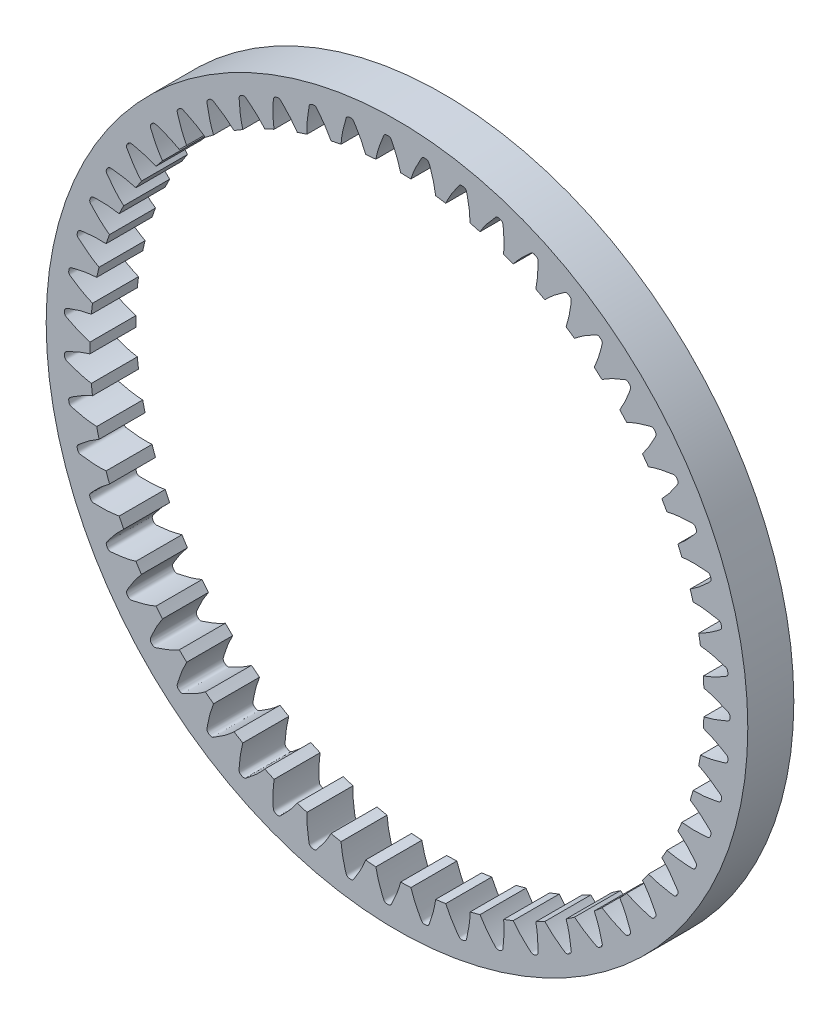
from build123d import *

# Parameters (mm, degrees)
SKETCHREVOLVESPURGEAR_W       = 4
SKETCHREVOLVESPURGEAR_H       = 4.799999985
TOOTHEXTRUDECUTSPURGEAR_DEPTH = 2
PATTERNSPURGEAR_COUNT         = 55
CUT_EXTRUDE2_DEPTH            = 45.592599845
CUT_EXTRUDE2_DEPTH_BACK       = 45.592599845
SKETCH4_R                     = 59.758715027
SKETCH4_R_2                   = 30.5


with BuildPart() as part:
    # SketchRevolveSpurGear → SpurGear (revolve)
    with BuildSketch(Plane(origin=(0, 0, 0), x_dir=(0, 0, -1), z_dir=(1, 0, 0))):
        with Locations((0, 29.099999595)):
            Rectangle(SKETCHREVOLVESPURGEAR_W, SKETCHREVOLVESPURGEAR_H)
    revolve(axis=Axis((0, 0, 0), (0, 0, -1)))

    # SketchToothSpurGear → ToothExtrudeCutSpurGear (cut, symmetric)
    with BuildSketch(Plane.XY):
        with BuildLine():
            ThreePointArc((26.661143645, -1.084352278), (26.683185723, 0), (26.661143645, 1.084352278))
            add(Edge.make_bspline(
                [(26.661143645, 1.084352278), (26.771290932, 1.060729715), (26.942432435, 1.019513731), (27.177626463, 0.954455679), (27.372992959, 0.895487945), (27.580268016, 0.827614446), (27.799153728, 0.750289731), (28.029240353, 0.662776702), (28.270468231, 0.565171604), (28.521257548, 0.454250779), (28.706807509, 0.374356526), (28.81694733, 0.315508201), (28.850580128, 0.289068648), (28.880055853, 0.258815186), (28.904962557, 0.224651266), (28.924808622, 0.187345426), (28.944073727, 0.134927799), (28.95060676, 0.082097448), (28.949865742, 0.032743292), (28.950066481, 0), (28.949865742, -0.032743292), (28.95060676, -0.082097448), (28.944073727, -0.134927799), (28.924808622, -0.187345426), (28.904962557, -0.224651266), (28.880055853, -0.258815186), (28.850580128, -0.289068648), (28.81694733, -0.315508201), (28.706807509, -0.374356526), (28.521257548, -0.454250779), (28.270468231, -0.565171604), (28.029240353, -0.662776702), (27.799153728, -0.750289731), (27.580268016, -0.827614446), (27.372992959, -0.895487945), (27.177626463, -0.954455679), (26.942432435, -1.019513731), (26.771290932, -1.060729715), (26.661143645, -1.084352278)],
                knots=[0, 0, 0, 0, 0.06368261, 0.099490553, 0.137942921, 0.179039714, 0.222780933, 0.269166577, 0.318196646, 0.36987114, 0.424190059, 0.432383721, 0.440322313, 0.448260906, 0.456199498, 0.46413809, 0.472076683, 0.487661443, 0.493830726, 0.5, 0.506169274, 0.512338557, 0.527923317, 0.53586191, 0.543800502, 0.551739094, 0.559677687, 0.567616279, 0.575809941, 0.63012886, 0.681803354, 0.730833423, 0.777219067, 0.820960286, 0.862057079, 0.900509447, 0.93631739, 1, 1, 1, 1], degree=3))
        make_face()
    toothextrudecutspurgear = extrude(amount=TOOTHEXTRUDECUTSPURGEAR_DEPTH, both=True, mode=Mode.SUBTRACT)

    # PatternSpurGear: ToothExtrudeCutSpurGear ×55 about axis
    patternspurgear_axis = Axis((0, 0, 55), (0, 0, -1))
    for i in range(1, PATTERNSPURGEAR_COUNT):
        add(toothextrudecutspurgear.rotate(patternspurgear_axis, i * 360 / PATTERNSPURGEAR_COUNT), mode=Mode.SUBTRACT)

    # Sketch4 → Cut-Extrude2 (cut, two sides: drawn at the far end of the back side and taken through both)
    with BuildSketch(Plane.XY.offset(-CUT_EXTRUDE2_DEPTH_BACK)):
        Circle(SKETCH4_R)
        Circle(SKETCH4_R_2, mode=Mode.SUBTRACT)
    extrude(amount=CUT_EXTRUDE2_DEPTH + CUT_EXTRUDE2_DEPTH_BACK, mode=Mode.SUBTRACT)


solid = part.part
